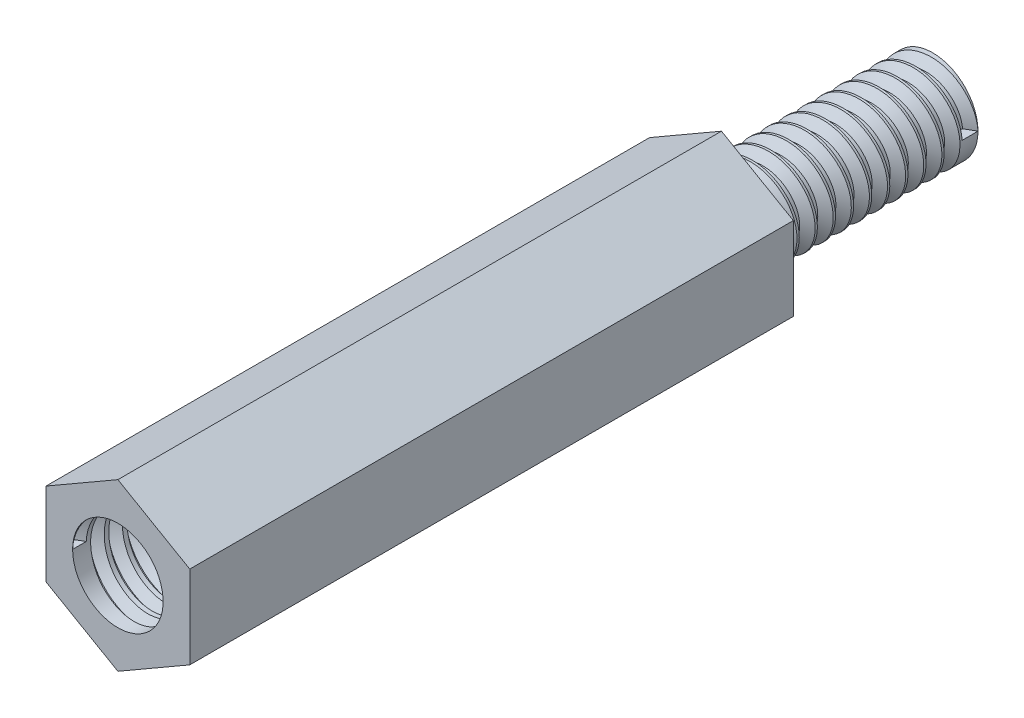
from build123d import *
from build123d.topology import SkipClean

# Parameters (mm, degrees)
BOSS_EXTRUDE1_DEPTH = 20
SKETCH2_R           = 1.5
CUT_EXTRUDE1_DEPTH  = 7
SKETCH3_R           = 1.5
BOSS_EXTRUDE2_DEPTH = 7
THREAD1_PITCH       = 0.6
THREAD2_PITCH       = 0.6


with BuildPart() as part:
    # Sketch1 → Boss-Extrude1 (new body)
    with BuildSketch(Plane.XY):
        Polygon((-2.38156986, -1.375), (0, -2.75), (2.38156986, -1.375), (2.38156986, 1.375), (0, 2.75), (-2.38156986, 1.375), align=None)
    extrude(amount=BOSS_EXTRUDE1_DEPTH)

    # Sketch2 → Cut-Extrude1 (cut)
    with BuildSketch(Plane.XY.offset(20)):
        Circle(SKETCH2_R)
    extrude(amount=-CUT_EXTRUDE1_DEPTH, mode=Mode.SUBTRACT)

    # Sketch3 → Boss-Extrude2 (add)
    with BuildSketch(Plane(origin=(0, 0, 0), x_dir=(-1, 0, 0), z_dir=(0, 0, -1))):
        with Locations(Location((0, 0, 0), (0, 0, 180))):
            Circle(SKETCH3_R)
    extrude(amount=BOSS_EXTRUDE2_DEPTH)

    # Thread1: the profile of Thread Profile1 profile screwed along a right-hand helix of 11.666667 turns, 6 arcs to a turn; built about Z, then put on its axis
    thread1_z = Axis((0, 0, 0), (0, 0, 1))
    thread1_corners = [(1.5003, 0, -0.000173205), (1.5003, 0, 0.525173203), (1.175240475, 0, 0.337499999), (1.175240475, 0, 0.187499999)]
    with BuildLine(mode=Mode.PRIVATE) as thread1_profile:
        Line(thread1_corners[0], thread1_corners[1])
        Line(thread1_corners[1], thread1_corners[2])
        Line(thread1_corners[2], thread1_corners[3])
        Line(thread1_corners[3], thread1_corners[0])
    thread1_cap = Face(thread1_profile.wire())
    thread1_turn_angles = [0, 30, 60, 90, 120, 150, 180, 210, 240, 270, 300, 330, 360]
    thread1_turn_weights = [1, 0.8660254037844387, 1, 0.8660254037844387, 1, 0.8660254037844387, 1, 0.8660254037844387, 1, 0.8660254037844387, 1, 0.8660254037844387, 1]
    thread1_turn_rails = [Edge.make_bspline([Vector(p[0], p[1], 0).rotate(thread1_z, thread1_turn_angles[k]) / thread1_turn_weights[k] + Vector(0, 0, p[2] + THREAD1_PITCH * thread1_turn_angles[k] / 360) for k in range(13)], [0, 0, 0, 1, 1, 2, 2, 3, 3, 4, 4, 5, 5, 6, 6, 6], 2, thread1_turn_weights) for p in thread1_corners]
    thread1_turn_sides = [Face.make_surface_from_curves(thread1_turn_rails[p[0]], thread1_turn_rails[p[1]]) for p in [(0, 1), (1, 2), (2, 3), (3, 0)]]
    thread1_last_angles = [3960, 3990, 4020, 4050, 4080, 4110, 4140, 4170, 4200]
    thread1_last_weights = [1, 0.8660254037844387, 1, 0.8660254037844387, 1, 0.8660254037844387, 1, 0.8660254037844387, 1]
    thread1_last_rails = [Edge.make_bspline([Vector(p[0], p[1], 0).rotate(thread1_z, thread1_last_angles[k]) / thread1_last_weights[k] + Vector(0, 0, p[2] + THREAD1_PITCH * thread1_last_angles[k] / 360) for k in range(9)], [0, 0, 0, 1, 1, 2, 2, 3, 3, 4, 4, 4], 2, thread1_last_weights) for p in thread1_corners]
    thread1_last_sides = [Face.make_surface_from_curves(thread1_last_rails[p[0]], thread1_last_rails[p[1]]) for p in [(0, 1), (1, 2), (2, 3), (3, 0)]]
    thread1 = Plane(origin=(0, 0, -7), x_dir=(1, 0, 0), z_dir=(0, 0, 1)) * Solid(Shell([*[p.moved(Location((0, 0, THREAD1_PITCH * i))) for i in range(11) for p in thread1_turn_sides], *thread1_last_sides, thread1_cap, thread1_cap.rotate(thread1_z, 4200).moved(Location((0, 0, THREAD1_PITCH * 4200 / 360)))]))
    add(thread1, mode=Mode.SUBTRACT)

    # Thread2: the profile of Thread Profile2 profile screwed along a right-hand helix of 11.666667 turns, 6 arcs to a turn; built about Z, then put on its axis
    with SkipClean():  # the faces are left unmerged after this step: merging them gives an invalid solid
        thread2_z = Axis((0, 0, 0), (0, 0, 1))
        thread2_corners = [(1.4997, 0, -0.000173205), (1.824759525, 0, 0.187499999), (1.824759525, 0, 0.262499999), (1.4997, 0, 0.450173203)]
        with BuildLine(mode=Mode.PRIVATE) as thread2_profile:
            Line(thread2_corners[0], thread2_corners[1])
            Line(thread2_corners[1], thread2_corners[2])
            Line(thread2_corners[2], thread2_corners[3])
            Line(thread2_corners[3], thread2_corners[0])
        thread2_cap = Face(thread2_profile.wire())
        thread2_turn_angles = [0, 30, 60, 90, 120, 150, 180, 210, 240, 270, 300, 330, 360]
        thread2_turn_weights = [1, 0.8660254037844387, 1, 0.8660254037844387, 1, 0.8660254037844387, 1, 0.8660254037844387, 1, 0.8660254037844387, 1, 0.8660254037844387, 1]
        thread2_turn_rails = [Edge.make_bspline([Vector(p[0], p[1], 0).rotate(thread2_z, thread2_turn_angles[k]) / thread2_turn_weights[k] + Vector(0, 0, p[2] + THREAD2_PITCH * thread2_turn_angles[k] / 360) for k in range(13)], [0, 0, 0, 1, 1, 2, 2, 3, 3, 4, 4, 5, 5, 6, 6, 6], 2, thread2_turn_weights) for p in thread2_corners]
        thread2_turn_sides = [Face.make_surface_from_curves(thread2_turn_rails[p[0]], thread2_turn_rails[p[1]]) for p in [(0, 1), (1, 2), (2, 3), (3, 0)]]
        thread2_last_angles = [3960, 3990, 4020, 4050, 4080, 4110, 4140, 4170, 4200]
        thread2_last_weights = [1, 0.8660254037844387, 1, 0.8660254037844387, 1, 0.8660254037844387, 1, 0.8660254037844426, 1]
        thread2_last_rails = [Edge.make_bspline([Vector(p[0], p[1], 0).rotate(thread2_z, thread2_last_angles[k]) / thread2_last_weights[k] + Vector(0, 0, p[2] + THREAD2_PITCH * thread2_last_angles[k] / 360) for k in range(9)], [0, 0, 0, 1, 1, 2, 2, 3, 3, 4, 4, 4], 2, thread2_last_weights) for p in thread2_corners]
        thread2_last_sides = [Face.make_surface_from_curves(thread2_last_rails[p[0]], thread2_last_rails[p[1]]) for p in [(0, 1), (1, 2), (2, 3), (3, 0)]]
        thread2 = Plane(origin=(0, 0, 20), x_dir=(-1, 0, 0), z_dir=(0, 0, -1)) * Solid(Shell([*[p.moved(Location((0, 0, THREAD2_PITCH * i))) for i in range(11) for p in thread2_turn_sides], *thread2_last_sides, thread2_cap, thread2_cap.rotate(thread2_z, 4200).moved(Location((0, 0, THREAD2_PITCH * 4200 / 360)))]))
        add(thread2, mode=Mode.SUBTRACT)


solid = part.part
